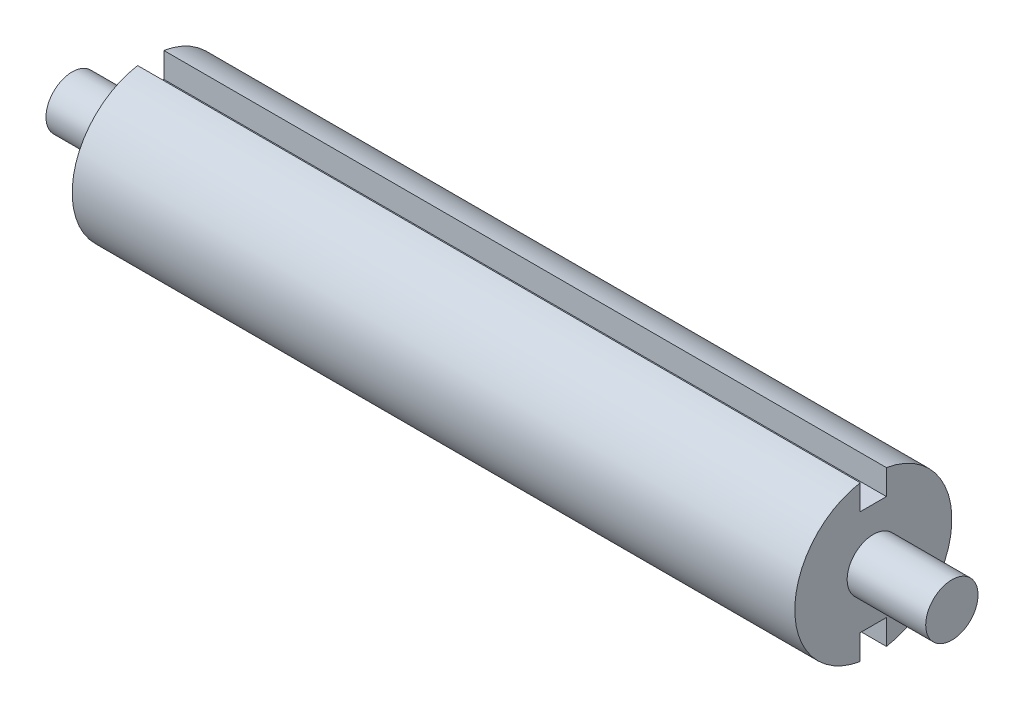
from build123d import *

# Parameters (mm, degrees)
SKETCH2_W          = 6.35
SKETCH2_H          = 6.35
CUT_EXTRUDE1_DEPTH = 197.168756687


with BuildPart() as part:
    # Sketch1 → Revolve1 (revolve)
    with BuildSketch(Plane(origin=(0, 0, 0), x_dir=(1, 0, 0), z_dir=(0, 1, 0))):
        Polygon((-106.68, 0), (106.68, 0), (106.68, 6.35), (87.63, 6.35), (87.63, 19.05), (-87.63, 19.05), (-87.63, 6.35), (-106.68, 6.35), align=None)
    revolve(axis=Axis((-106.68, 0, 0), (1, 0, 0)))

    # Sketch2 → Cut-Extrude1 (cut, through all)
    with BuildSketch(Plane(origin=(87.63, 0, 0), x_dir=(0, 0, -1), z_dir=(1, 0, 0))):
        with Locations((0, 15.875)):
            Rectangle(SKETCH2_W, SKETCH2_H)
        with Locations((0, -15.875)):
            Rectangle(SKETCH2_W, SKETCH2_H)
    extrude(amount=-CUT_EXTRUDE1_DEPTH, mode=Mode.SUBTRACT)


solid = part.part
